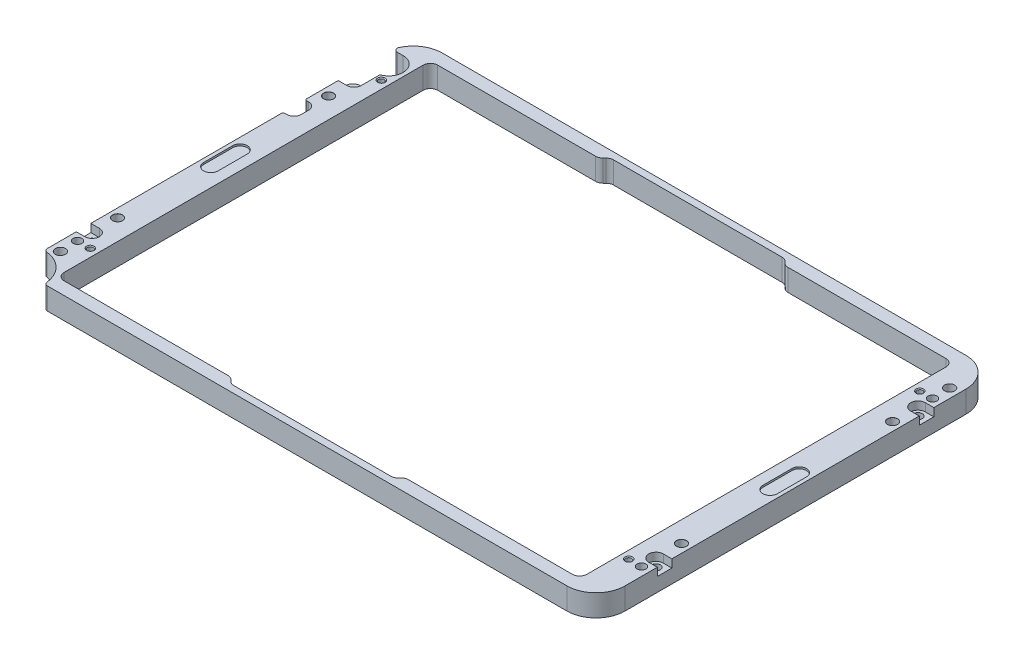
from build123d import *

# Parameters (mm, degrees)
SKETCH1_W                            = 159.7
SKETCH1_H                            = 109.7
SKETCH1_W_2                          = 143.7
SKETCH1_H_2                          = 102.7
BOSS_EXTRUDE1_DEPTH                  = 6
F_2_4_2_4_DIAMETER_HOLE1_D           = 2.4
CUT_EXTRUDE10_DEPTH                  = 2.2
LPATTERN1_COUNT                      = 2
LPATTERN1_PITCH                      = 72
MIRROR2_COPY_1_DEPTH                 = 2.2
M2X0_4_TAPPED_HOLE1_D                = 1.6
M2X0_4_TAPPED_HOLE1_DEPTH            = 3.5
M2X0_4_TAPPED_HOLE1_CSINK_D          = 2.05
M2X0_4_TAPPED_HOLE1_CSINK_ANGLE      = 90
M2X0_4_TAPPED_HOLE1_TIP              = 0.480688495
CUT_EXTRUDE3_DEPTH                   = 0.5
SKETCH11_W                           = 4.35
SKETCH11_H                           = 6
CUT_EXTRUDE4_DEPTH                   = 2.2
CUT_EXTRUDE11_DEPTH                  = 97.948362544
CUT_EXTRUDE11_DEPTH_BACK             = 97.948362544
F_2_4_2_4_DIAMETER_HOLE2_D           = 2.4
F_2_7_2_7_DIAMETER_HOLE1_D           = 2.7
F_2_7_2_7_DIAMETER_HOLE1_CSINK_D     = 2.75
F_2_7_2_7_DIAMETER_HOLE1_CSINK_ANGLE = 90
CUT_EXTRUDE6_DEPTH                   = 98.059492065
SKETCH19_R                           = 1.4
CUT_EXTRUDE7_DEPTH                   = 3.5
SKETCH32_R                           = 1.375
BOSS_EXTRUDE2_DEPTH                  = 1
CUT_EXTRUDE8_DEPTH                   = 98.126438213
SKETCH8_R                            = 8
CUT_EXTRUDE9_DEPTH                   = 98.126438213
FILLET1_R                            = 2
FILLET2_R                            = 8
FILLET3_R                            = 1
FILLET4_R                            = 2
FILLET5_R                            = 0.5
SKETCH31_W                           = 48
SKETCH31_H                           = 1.6
CUT_EXTRUDE12_DEPTH                  = 98.126438213
CHAMFER1_START                       = -1
CHAMFER1_DEPTH                       = 8
CHAMFER1_2_DEPTH                     = 6
FILLET6_R                            = 2


with BuildPart() as part:
    # Sketch1 → Boss-Extrude1 (new body)
    with BuildSketch(Plane(origin=(0, 0, 0), x_dir=(1, 0, 0), z_dir=(0, 1, 0))):
        Rectangle(SKETCH1_W, SKETCH1_H)
        Rectangle(SKETCH1_W_2, SKETCH1_H_2, mode=Mode.SUBTRACT)
    extrude(amount=BOSS_EXTRUDE1_DEPTH)

    # Ø2.4 (2.4) Diameter Hole1 (through all)
    with Locations(Plane(origin=(0, 6, 0), x_dir=(1, 0, 0), z_dir=(0, 1, 0))):
        with Locations((-77.5, 36), (77.5, 36), (-77.5, -36), (77.5, -36)):
            Hole(F_2_4_2_4_DIAMETER_HOLE1_D / 2)

    # Sketch29 → Cut-Extrude10 (cut)
    with BuildSketch(Plane(origin=(0, 6, 0), x_dir=(1, 0, 0), z_dir=(0, 1, 0))):
        with BuildLine():
            Line((-77.5, 38), (-79.85, 38))
            Line((-79.85, 38), (-79.85, 34))
            Line((-79.85, 34), (-77.5, 34))
            ThreePointArc((-77.5, 34), (-75.5, 36), (-77.5, 38))
        make_face()
    cut_extrude10 = extrude(amount=-CUT_EXTRUDE10_DEPTH, mode=Mode.SUBTRACT)

    # LPattern1: Cut-Extrude10 ×2
    with Locations(*[(0, 0, i * LPATTERN1_PITCH) for i in range(1, LPATTERN1_COUNT)]):
        add(cut_extrude10, mode=Mode.SUBTRACT)

    # Mirror2: Cut-Extrude10 across plane
    add(cut_extrude10.mirror(Plane(origin=(0, 0, 0), x_dir=(0, 0, 1), z_dir=(1, 0, 0))), mode=Mode.SUBTRACT)

    # Mirror2 copy 1 sketch → Mirror2 copy 1 (cut)
    with BuildSketch(Plane(origin=(0, 6, 72), x_dir=(-1, 0, 0), z_dir=(0, 1, 0))):
        with BuildLine():
            Line((-77.5, -38), (-79.85, -38))
            Line((-79.85, -38), (-79.85, -34))
            Line((-79.85, -34), (-77.5, -34))
            ThreePointArc((-77.5, -34), (-75.5, -36), (-77.5, -38))
        make_face()
    extrude(amount=-MIRROR2_COPY_1_DEPTH, mode=Mode.SUBTRACT)

    # M2x0.4 Tapped Hole1
    with Locations(Plane(origin=(0, 6, 0), x_dir=(1, 0, 0), z_dir=(0, 1, 0))):
        with Locations((-74, 40), (-74, -40), (74, 40), (74, -40)):
            CounterSinkHole(M2X0_4_TAPPED_HOLE1_D / 2, M2X0_4_TAPPED_HOLE1_CSINK_D / 2, depth=M2X0_4_TAPPED_HOLE1_DEPTH, counter_sink_angle=M2X0_4_TAPPED_HOLE1_CSINK_ANGLE)
            with Locations((0, 0, -(M2X0_4_TAPPED_HOLE1_DEPTH + M2X0_4_TAPPED_HOLE1_TIP / 2))):  # 118° drill point
                Cone(0, M2X0_4_TAPPED_HOLE1_D / 2, M2X0_4_TAPPED_HOLE1_TIP, mode=Mode.SUBTRACT)

    # Sketch9 → Cut-Extrude3 (cut)
    with BuildSketch(Plane(origin=(0, 6, 0), x_dir=(1, 0, 0), z_dir=(0, 1, 0))):
        with BuildLine():
            Line((-74.85, 4), (-74.85, -4))
            ThreePointArc((-74.85, -4), (-76.85, -6), (-78.85, -4))
            Line((-78.85, -4), (-78.85, 4))
            ThreePointArc((-78.85, 4), (-76.85, 6), (-74.85, 4))
        make_face()
    cut_extrude3 = extrude(amount=-CUT_EXTRUDE3_DEPTH, mode=Mode.SUBTRACT)

    # Mirror1: Cut-Extrude3 across plane
    add(cut_extrude3.mirror(Plane(origin=(0, 0, 0), x_dir=(0, 0, 1), z_dir=(1, 0, 0))), mode=Mode.SUBTRACT)

    # Sketch11 → Cut-Extrude4 (cut)
    with BuildSketch(Plane(origin=(0, 6, 0), x_dir=(1, 0, 0), z_dir=(0, 1, 0))):
        with Locations((-77.675, 39)):
            Rectangle(SKETCH11_W, SKETCH11_H)
    extrude(amount=-CUT_EXTRUDE4_DEPTH, mode=Mode.SUBTRACT)

    # Sketch30 → Cut-Extrude11 (cut, two sides: drawn at the far end of the back side and taken through both)
    with BuildSketch(Plane(origin=(0, 3.8, 0), x_dir=(1, 0, 0), z_dir=(0, 1, 0)).offset(-CUT_EXTRUDE11_DEPTH_BACK)):
        with BuildLine():
            Line((-75.5, 40), (-75.5, 42))
            Line((-75.5, 42), (-79.85, 42))
            Line((-79.85, 42), (-79.85, 38))
            Line((-79.85, 38), (-77.5, 38))
            ThreePointArc((-77.5, 38), (-76.085786438, 38.585786438), (-75.5, 40))
        make_face()
    extrude(amount=CUT_EXTRUDE11_DEPTH + CUT_EXTRUDE11_DEPTH_BACK, mode=Mode.SUBTRACT)

    # Ø2.4 (2.4) Diameter Hole2 (through all)
    with Locations(Plane(origin=(0, 6, 0), x_dir=(1, 0, 0), z_dir=(0, 1, 0))):
        with Locations((-77.5, -40), (77.5, 40), (77.5, -40)):
            Hole(F_2_4_2_4_DIAMETER_HOLE2_D / 2)

    # Ø2.7 (2.7) Diameter Hole1 (through all)
    with Locations(Plane(origin=(0, 6, 0), x_dir=(1, 0, 0), z_dir=(0, 1, 0))):
        with Locations((-77.5, 29), (-77.5, -29), (77.5, 29), (77.5, -29)):
            CounterSinkHole(F_2_7_2_7_DIAMETER_HOLE1_D / 2, F_2_7_2_7_DIAMETER_HOLE1_CSINK_D / 2, counter_sink_angle=F_2_7_2_7_DIAMETER_HOLE1_CSINK_ANGLE)

    # Sketch18 → Cut-Extrude6 (cut, through all)
    with BuildSketch(Plane(origin=(0, 6, 0), x_dir=(1, 0, 0), z_dir=(0, 1, 0))):
        with BuildLine():
            Line((-78.85, 24.85), (-79.85, 24.85))
            Line((-79.85, 24.85), (-79.85, 18.85))
            Line((-79.85, 18.85), (-78.85, 18.85))
            ThreePointArc((-78.85, 18.85), (-77.435786438, 19.435786438), (-76.85, 20.85))
            Line((-76.85, 20.85), (-76.85, 22.85))
            ThreePointArc((-76.85, 22.85), (-77.435786438, 24.264213562), (-78.85, 24.85))
        make_face()
    extrude(amount=-CUT_EXTRUDE6_DEPTH, mode=Mode.SUBTRACT)

    # Sketch19 → Cut-Extrude7 (cut)
    with BuildSketch(Plane(origin=(0, 6, 0), x_dir=(1, 0, 0), z_dir=(0, 1, 0))):
        with Locations(Location((77.35, 44.85, 0), (0, 0, 270))):
            Circle(SKETCH19_R)
        with Locations(Location((-77.35, -44.85, 0), (0, 0, 270))):
            Circle(SKETCH19_R)
    extrude(amount=-CUT_EXTRUDE7_DEPTH, mode=Mode.SUBTRACT)

    # Sketch32 → Boss-Extrude2 (add)
    with BuildSketch(Plane.XZ):
        with Locations(Location((-77.35, 44.85, 0), (0, 0, 90))):
            Circle(SKETCH32_R)
        with Locations(Location((77.35, -44.85, 0), (0, 0, 90))):
            Circle(SKETCH32_R)
    extrude(amount=BOSS_EXTRUDE2_DEPTH)

    # Sketch7 → Cut-Extrude8 (cut, through all)
    with BuildSketch(Plane(origin=(0, 6, 0), x_dir=(1, 0, 0), z_dir=(0, 1, 0))):
        with BuildLine():
            Line((-76.85, 48.85), (-79.85, 48.85))
            Line((-79.85, 48.85), (-79.85, 40.85))
            Line((-79.85, 40.85), (-76.85, 40.85))
            ThreePointArc((-76.85, 40.85), (-72.85, 44.85), (-76.85, 48.85))
        make_face()
    extrude(amount=-CUT_EXTRUDE8_DEPTH, mode=Mode.SUBTRACT)

    # Sketch8 → Cut-Extrude9 (cut, through all)
    with BuildSketch(Plane(origin=(0, 6, 0), x_dir=(1, 0, 0), z_dir=(0, 1, 0))):
        with Locations((-79.85, -54.85)):
            Circle(SKETCH8_R)
    extrude(amount=-CUT_EXTRUDE9_DEPTH, mode=Mode.SUBTRACT)

    # Fillet1
    fillet1_edges = [part.edges().sort_by_distance(p)[0] for p in [
        (71.85, 3, 51.35),
        (71.85, 3, -51.35),
        (-71.85, 3, -51.35),
        (-71.85, 3, 51.35),
    ]]
    fillet(fillet1_edges, radius=FILLET1_R)

    # Fillet2
    # the kernel refuses this fillet: 8 mm, written as the material it takes off along each edge
    with BuildSketch(Plane(origin=(79.85, -20, 54.85), x_dir=(-1, 0, 0), z_dir=(0, 1, 0)), Plane(origin=(79.85, -20, -54.85), x_dir=(0, 0, 1), z_dir=(0, 1, 0))) as fillet2_piece_1:
        with BuildLine():
            CenterArc((FILLET2_R, -FILLET2_R), FILLET2_R, 90, 90)
            Line((0, -FILLET2_R), (-FILLET2_R * 0.02, -FILLET2_R))
            Line((-FILLET2_R * 0.02, -FILLET2_R), (-FILLET2_R * 0.02, FILLET2_R * 0.02))
            Line((-FILLET2_R * 0.02, FILLET2_R * 0.02), (FILLET2_R, FILLET2_R * 0.02))
            Line((FILLET2_R, FILLET2_R * 0.02), (FILLET2_R, 0))
        make_face()
    extrude(amount=46, mode=Mode.SUBTRACT)
    with BuildSketch(Plane(origin=(-79.85, -19.364916731, -54.85), x_dir=(1, 0, 0), z_dir=(0, 1, 0))) as fillet2_piece_2:
        with BuildLine():
            CenterArc((7.745966692, -8), FILLET2_R, 90, 75.522487814)
            Line((0, -6), (-0.154919334, -5.96))
            ThreePointArc((-0.154919334, -5.96), (-0.16, -3), (-0.16, 0))
            Line((-0.16, 0), (0, 0.16))
            Line((0, 0.16), (7.745966692, 0.16))
            Line((7.745966692, 0.16), (7.745966692, 0))
        make_face()
    extrude(amount=44.729833462, mode=Mode.SUBTRACT)

    # Fillet3
    fillet3_edges = [part.edges().sort_by_distance(p)[0] for p in [
        (-79.85, 3, -48.85),
        (-71.85, 3, 54.85),
        (-79.85, 3, 46.85),
    ]]
    fillet(fillet3_edges, radius=FILLET3_R)

    # Fillet4
    fillet4_edges = [part.edges().sort_by_distance(p)[0] for p in [
        (-79.85, 1.9, -38),
    ]]
    fillet(fillet4_edges, radius=FILLET4_R)

    # Fillet5
    fillet5_edges = [part.edges().sort_by_distance(p)[0] for p in [
        (-79.85, 3, -18.85),
        (-79.85, 3, -24.85),
    ]]
    fillet(fillet5_edges, radius=FILLET5_R)

    # Sketch31 → Cut-Extrude12 (cut, through all)
    with BuildSketch(Plane(origin=(0, 6, 0), x_dir=(1, 0, 0), z_dir=(0, 1, 0))):
        with Locations((0, 52.15)):
            Rectangle(SKETCH31_W, SKETCH31_H)
    cut_extrude12 = extrude(amount=-CUT_EXTRUDE12_DEPTH, mode=Mode.SUBTRACT)

    # Mirror3: Cut-Extrude12 across plane
    add(cut_extrude12.mirror(Plane.XY), mode=Mode.SUBTRACT)

    # Chamfer1: read off the stored shape, not the designer's step
    # Chamfer1 outline → Chamfer1 (cut)
    with BuildSketch(Plane(origin=(0, 0, 0), x_dir=(1, 0, 0), z_dir=(0, 1, 0)).offset(CHAMFER1_START)):
        Polygon((25.6, 51.35), (24, 52.95), (24, 51.35), align=None)
        Polygon((-24, 52.95), (-25.6, 51.35), (-24, 51.35), align=None)
    extrude(amount=CHAMFER1_DEPTH, mode=Mode.SUBTRACT)

    # Chamfer1 2 outline → Chamfer1 2 (add)
    with BuildSketch(Plane(origin=(0, 0, 0), x_dir=(1, 0, 0), z_dir=(0, 1, 0))):
        Polygon((24, -52.95), (24, -51.35), (22.4, -52.95), align=None)
        Polygon((-24, -52.95), (-22.4, -52.95), (-24, -51.35), align=None)
    extrude(amount=CHAMFER1_2_DEPTH)

    # Fillet6
    fillet6_edges = [part.edges().sort_by_distance(p)[0] for p in [
        (-24, 3, -52.95),
        (24, 3, -52.95),
        (24, 3, 51.35),
        (-24, 3, 51.35),
        (-22.4, 3, 52.95),
        (22.4, 3, 52.95),
        (25.6, 3, -51.35),
        (-25.6, 3, -51.35),
    ]]
    fillet(fillet6_edges, radius=FILLET6_R)


solid = part.part
